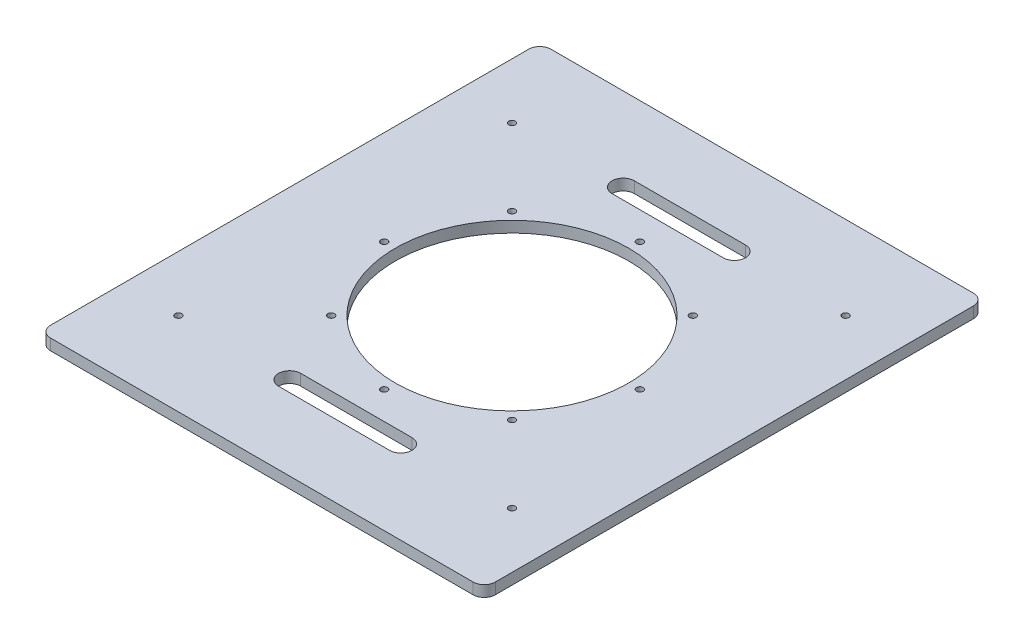
from build123d import *

# Parameters (mm, degrees)
EXTRUDE_1_DEPTH     = 10
SKETCH_3_R          = 105
SKETCH_3_R_2        = 3
CUT_EXTRUDE_1_DEPTH = 15


with BuildPart() as part:
    # 草圖1 → 填料-伸長1 (new body)
    with BuildSketch(Plane(origin=(0, 0, 0), x_dir=(1, 0, 0), z_dir=(0, 1, 0))):
        with BuildLine():
            Line((-200, 215), (-200, -215))
            ThreePointArc((-200, -215), (-197.071067812, -222.071067812), (-190, -225))
            Line((-190, -225), (190, -225))
            ThreePointArc((190, -225), (197.071067812, -222.071067812), (200, -215))
            Line((200, -215), (200, 215))
            ThreePointArc((200, 215), (197.071067812, 222.071067812), (190, 225))
            Line((190, 225), (-190, 225))
            ThreePointArc((-190, 225), (-197.071067812, 222.071067812), (-200, 215))
        make_face()
    extrude(amount=EXTRUDE_1_DEPTH)

    # 草圖3 → 除料-伸長1 (cut)
    with BuildSketch(Plane(origin=(0, 10, 0), x_dir=(1, 0, 0), z_dir=(0, 1, 0))):
        Circle(SKETCH_3_R)
        with Locations((0, 115)):
            Circle(SKETCH_3_R_2)
        with Locations((81.317279836, 81.317279836)):
            Circle(SKETCH_3_R_2)
        with Locations((115, 0)):
            Circle(SKETCH_3_R_2)
        with Locations((81.317279836, -81.317279836)):
            Circle(SKETCH_3_R_2)
        with Locations((0, -115)):
            Circle(SKETCH_3_R_2)
        with Locations((-81.317279836, -81.317279836)):
            Circle(SKETCH_3_R_2)
        with Locations((-115, 0)):
            Circle(SKETCH_3_R_2)
        with Locations((-81.317279836, 81.317279836)):
            Circle(SKETCH_3_R_2)
        with Locations((-150, 150)):
            Circle(SKETCH_3_R_2)
        with Locations((150, 150)):
            Circle(SKETCH_3_R_2)
        with Locations((-150, -150)):
            Circle(SKETCH_3_R_2)
        with Locations((150, -150)):
            Circle(SKETCH_3_R_2)
        with BuildLine():
            Line((-50, -140), (50, -140))
            ThreePointArc((50, -140), (60, -150), (50, -160))
            Line((50, -160), (-50, -160))
            ThreePointArc((-50, -160), (-60, -150), (-50, -140))
        make_face()
        with BuildLine():
            Line((-50, 140), (50, 140))
            ThreePointArc((50, 140), (60, 150), (50, 160))
            Line((50, 160), (-50, 160))
            ThreePointArc((-50, 160), (-60, 150), (-50, 140))
        make_face()
    extrude(amount=-CUT_EXTRUDE_1_DEPTH, mode=Mode.SUBTRACT)


solid = part.part
